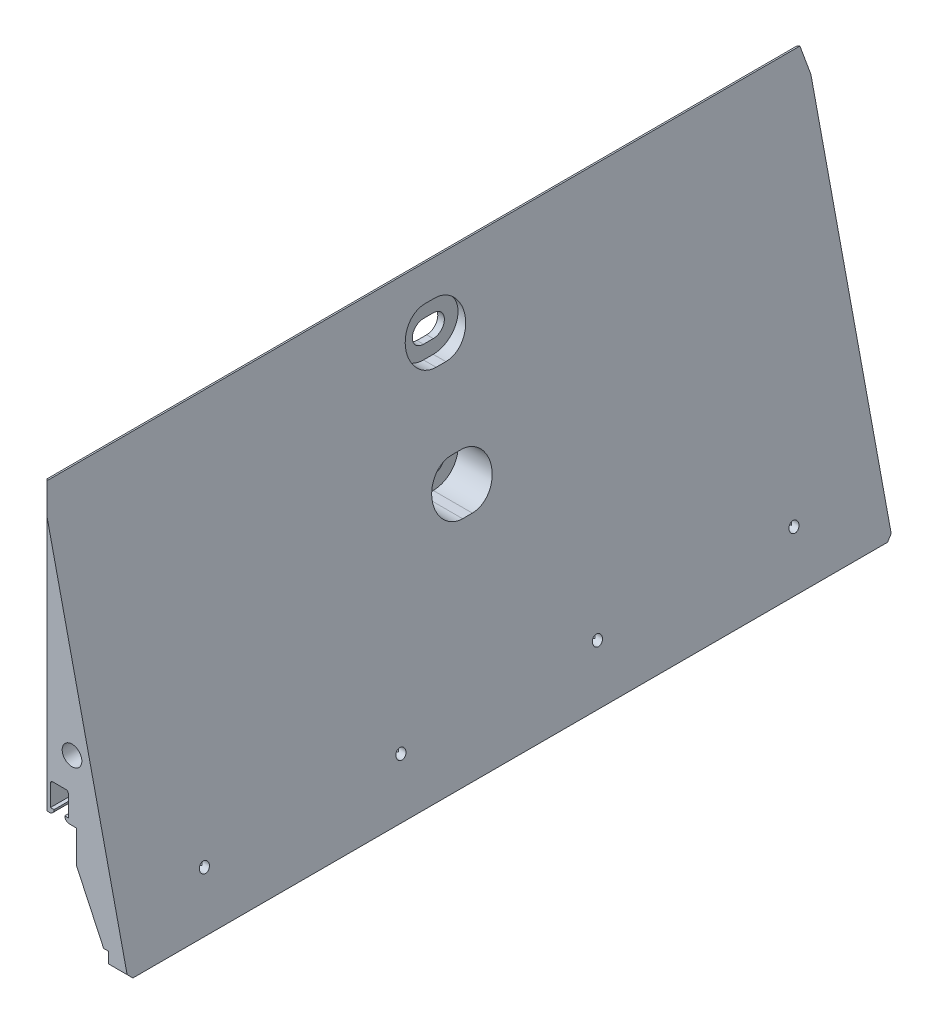
from build123d import *

# Parameters (mm, degrees)
BOSS_EXTRUDE1_DEPTH                = 61.7191425
CBORE_START                        = 1.064
CBORE_SLOT_FOR_M3_SHCS1_DEPTH      = 6.323125366
CBORE_SLOT_FOR_M3_SHCS1_2_DEPTH    = 1.064
SKETCH6_W                          = 11.1125
SKETCH6_H                          = 123.438285
CUT_EXTRUDE1_DEPTH                 = 2.54
SKETCH7_W                          = 6.35
SKETCH7_H                          = 123.438285
CUT_EXTRUDE2_DEPTH                 = 20.30984
BOSS_EXTRUDE2_START                = -61.719142
BOSS_EXTRUDE2_DEPTH                = 123.438284
SKETCH9_W                          = 0.5715
SKETCH9_H                          = 123.438285
BOSS_EXTRUDE3_DEPTH                = 5.6642
FILLET2_R                          = 0.381
CHAMFER2_SIZE                      = 0.762
CHAMFER3_SIZE                      = 3.96875
CHAMFER3_SIZE2                     = 8.511011841
AIR_ASSIST_HOLES_REACH             = 100.109
AIR_START                          = 9.128125
SKETCH11_R                         = 0.79375
F_1_8_0_125_DIAMETER_HOLE1_D       = 3.175
SKETCH13_R                         = 1.190625
CUT_EXTRUDE4_DEPTH                 = 49.2125
F_1_8_0_125_DIAMETER_HOLE2_REACH   = 90.981
F_1_8_0_125_DIAMETER_HOLE2_BORE_R  = 1.5875
M5X0_8_TAPPED_HOLE1_D              = 4.2
M5X0_8_TAPPED_HOLE1_DEPTH          = 4.7752
M5X0_8_TAPPED_HOLE1_TIP            = 1.2618073
MATERIAL_FOR_ANGLED_AIR_PORT_DEPTH = 123.438285


# Read off the part's stored shape, not the designer's step: CBORE SLOT for M3 SHCS1
with BuildPart() as part:
    # Sketch1 → Boss-Extrude1 (new, symmetric)
    with BuildSketch(Plane.XY):
        Polygon((0, 0), (14.2875, 0), (0.254, 62.484), (0, 62.484), align=None)
    extrude(amount=BOSS_EXTRUDE1_DEPTH, both=True)

    # CBORE SLOT for M3 SHCS1 outline → CBORE SLOT for M3 SHCS1 (cut)
    with BuildSketch(Plane.YZ.offset(CBORE_START)):
        with BuildLine():
            ThreePointArc((57.77484, 0.7866), (53.77434, 4.7871), (49.77384, 0.7866))
            Line((49.77384, 0.7866), (49.77384, -0.7866))
            ThreePointArc((49.77384, -0.7866), (53.77434, -4.7871), (57.77484, -0.7866))
            Line((57.77484, -0.7866), (57.77484, 0.7866))
        make_face()
        with BuildLine():
            ThreePointArc((38.72484, 0.7866), (34.72434, 4.7871), (30.72384, 0.7866))
            Line((30.72384, 0.7866), (30.72384, -0.7866))
            ThreePointArc((30.72384, -0.7866), (34.72434, -4.7871), (38.72484, -0.7866))
            Line((38.72484, -0.7866), (38.72484, 0.7866))
        make_face()
    extrude(amount=CBORE_SLOT_FOR_M3_SHCS1_DEPTH, mode=Mode.SUBTRACT)

    # CBORE SLOT for M3 SHCS1 2 outline → CBORE SLOT for M3 SHCS1 2 (cut)
    with BuildSketch(Plane.YZ):
        with BuildLine():
            Line((55.57434, -0.7866), (55.57434, 0.7866))
            ThreePointArc((55.57434, 0.7866), (53.77434, 2.5866), (51.97434, 0.7866))
            Line((51.97434, 0.7866), (51.97434, -0.7866))
            ThreePointArc((51.97434, -0.7866), (53.77434, -2.5866), (55.57434, -0.7866))
        make_face()
        with BuildLine():
            Line((36.52434, -0.7866), (36.52434, 0.7866))
            ThreePointArc((36.52434, 0.7866), (34.72434, 2.5866), (32.92434, 0.7866))
            Line((32.92434, 0.7866), (32.92434, -0.7866))
            ThreePointArc((32.92434, -0.7866), (34.72434, -2.5866), (36.52434, -0.7866))
        make_face()
    extrude(amount=CBORE_SLOT_FOR_M3_SHCS1_2_DEPTH, mode=Mode.SUBTRACT)

    # Sketch6 → Cut-Extrude1 (cut)
    with BuildSketch(Plane.XZ):
        with Locations((5.55625, 0)):
            Rectangle(SKETCH6_W, SKETCH6_H)
    extrude(amount=-CUT_EXTRUDE1_DEPTH, mode=Mode.SUBTRACT)

    # Sketch7 → Cut-Extrude2 (cut)
    with BuildSketch(Plane.XZ.offset(-2.54)):
        with Locations((3.175, 0)):
            Rectangle(SKETCH7_W, SKETCH7_H)
    extrude(amount=-CUT_EXTRUDE2_DEPTH, mode=Mode.SUBTRACT)

    # Sketch8 → Boss-Extrude2 (add)
    with BuildSketch(Plane.XY.offset(BOSS_EXTRUDE2_START)):
        with BuildLine():
            Line((5.7785, 22.84984), (5.7785, 17.18564))
            Line((5.7785, 17.18564), (4.8006, 17.18564))
            ThreePointArc((4.8006, 17.18564), (4.261784633, 17.408824633), (4.0386, 17.94764))
            Line((4.0386, 17.94764), (4.6228, 17.94764))
            Line((4.6228, 17.94764), (4.6228, 21.73224))
            Line((4.6228, 21.73224), (1.7272, 21.73224))
            Line((1.7272, 21.73224), (1.7272, 17.94764))
            Line((1.7272, 17.94764), (2.3114, 17.94764))
            ThreePointArc((2.3114, 17.94764), (2.088215367, 17.408824633), (1.5494, 17.18564))
            Line((1.5494, 17.18564), (0.5715, 17.18564))
            Line((0.5715, 17.18564), (0.5715, 22.84984))
            Line((0.5715, 22.84984), (5.7785, 22.84984))
        make_face()
    extrude(amount=BOSS_EXTRUDE2_DEPTH)

    # Sketch9 → Boss-Extrude3 (add)
    with BuildSketch(Plane.XZ.offset(-17.18564)):
        with Locations((6.06425, 0)):
            Rectangle(SKETCH9_W, SKETCH9_H)
    extrude(amount=-BOSS_EXTRUDE3_DEPTH)

    # Fillet2
    fillet2_edges = [part.edges().sort_by_distance(p)[0] for p in [
        (1.7272, 21.73224, 0),
        (4.6228, 21.73224, 0),
    ]]
    fillet(fillet2_edges, radius=FILLET2_R)

    # Chamfer2
    chamfer2_edges = [part.edges().sort_by_distance(p)[0] for p in [
        (12.7, 0, -61.7191425),
        (12.7, 0, 61.7191425),
    ]]
    chamfer(chamfer2_edges, length=CHAMFER2_SIZE)

    # Chamfer3
    chamfer3_edges = [part.edges().sort_by_distance(p)[0] for p in [
        (6.35, 2.54, 0),
    ]]
    chamfer3_side = [part.faces().sort_by_distance(p)[0] for p in [
        (8.73125, 2.54, 0),
    ]]
    chamfer(chamfer3_edges, length=CHAMFER3_SIZE, length2=CHAMFER3_SIZE2, reference=chamfer3_side[0])

    # Chamfer1
    # the kernel refuses this chamfer: 1.143 mm, written as the material it takes off along each edge
    with BuildSketch(Plane(origin=(0, 69.538640773, 61.7191425), x_dir=(0.9996219169112965, 0, 0.027495876610588797), z_dir=(0, -1, 0)), Plane(origin=(0, 69.538640773, -61.7191425), x_dir=(-0.027495876610586282, 0, 0.9996219169112968), z_dir=(0, -1, 0))) as chamfer1_piece_1:
        with BuildLine():
            Line((1.175773462, 0), (-0.064633398, -1.173995638))
            Line((-0.064633398, -1.173995638), (-0.087484755, -1.173367082))
            ThreePointArc((-0.087484755, -1.173367082), (-0.039009707, -0.586813719), (-0.022851357, 0.000628556))
            Line((-0.022851357, 0.000628556), (0.000628556, 0.022851357))
            ThreePointArc((0.000628556, 0.022851357), (0.588070831, 0.006693008), (1.176402018, 0.022851357))
            Line((1.176402018, 0.022851357), (1.175773462, 0))
        make_face()
    extrude(amount=53.743441545, mode=Mode.SUBTRACT)

    # Air assist holes: up to this plane
    air_assist_holes_end = Plane(origin=(14.2875, 0, 61.7191425), z_dir=(-0.9756946233195241, -0.21913466641627521, 0))
    # Sketch11 → Air assist holes (cut, up to the surface)
    with BuildSketch(Plane(origin=(0, 0, 0), x_dir=(0, 0, -1), z_dir=(1, 0, 0)).offset(AIR_START), mode=Mode.PRIVATE) as air_assist_holes_sk1:
        with Locations(Location((-15.875, 7.9375, 0), (0, 0, 90))):
            Circle(SKETCH11_R)
    air_assist_holes_tool1 = split(extrude(air_assist_holes_sk1.sketch, amount=AIR_ASSIST_HOLES_REACH, mode=Mode.PRIVATE), bisect_by=air_assist_holes_end, keep=Keep.BOTH, mode=Mode.PRIVATE)
    add(air_assist_holes_tool1.solids().sort_by_distance((9.128125, 7.9375, 15.875))[0], mode=Mode.SUBTRACT)
    # Sketch11 → Air assist holes (cut, up to the surface)
    with BuildSketch(Plane(origin=(0, 0, 0), x_dir=(0, 0, -1), z_dir=(1, 0, 0)).offset(AIR_START), mode=Mode.PRIVATE) as air_assist_holes_sk2:
        with Locations(Location((-47.625, 7.9375, 0), (0, 0, 90))):
            Circle(SKETCH11_R)
    air_assist_holes_tool2 = split(extrude(air_assist_holes_sk2.sketch, amount=AIR_ASSIST_HOLES_REACH, mode=Mode.PRIVATE), bisect_by=air_assist_holes_end, keep=Keep.BOTH, mode=Mode.PRIVATE)
    add(air_assist_holes_tool2.solids().sort_by_distance((9.128125, 7.9375, 47.625))[0], mode=Mode.SUBTRACT)
    # Sketch11 → Air assist holes (cut, up to the surface)
    with BuildSketch(Plane(origin=(0, 0, 0), x_dir=(0, 0, -1), z_dir=(1, 0, 0)).offset(AIR_START), mode=Mode.PRIVATE) as air_assist_holes_sk3:
        with Locations(Location((47.625, 7.9375, 0), (0, 0, 180))):
            Circle(SKETCH11_R)
    air_assist_holes_tool3 = split(extrude(air_assist_holes_sk3.sketch, amount=AIR_ASSIST_HOLES_REACH, mode=Mode.PRIVATE), bisect_by=air_assist_holes_end, keep=Keep.BOTH, mode=Mode.PRIVATE)
    add(air_assist_holes_tool3.solids().sort_by_distance((9.128125, 7.9375, -47.625))[0], mode=Mode.SUBTRACT)
    # Sketch11 → Air assist holes (cut, up to the surface)
    with BuildSketch(Plane(origin=(0, 0, 0), x_dir=(0, 0, -1), z_dir=(1, 0, 0)).offset(AIR_START), mode=Mode.PRIVATE) as air_assist_holes_sk4:
        with Locations(Location((15.875, 7.9375, 0), (0, 0, 180))):
            Circle(SKETCH11_R)
    air_assist_holes_tool4 = split(extrude(air_assist_holes_sk4.sketch, amount=AIR_ASSIST_HOLES_REACH, mode=Mode.PRIVATE), bisect_by=air_assist_holes_end, keep=Keep.BOTH, mode=Mode.PRIVATE)
    add(air_assist_holes_tool4.solids().sort_by_distance((9.128125, 7.9375, -15.875))[0], mode=Mode.SUBTRACT)

    # 1/8 (0.125) Diameter Hole1 (through all)
    with Locations(Plane.XY.offset(61.7191425)):
        with Locations((5.214317884, 26.9875)):
            Hole(F_1_8_0_125_DIAMETER_HOLE1_D / 2)

    # Sketch13 → Cut-Extrude4 (cut)
    with BuildSketch(Plane(origin=(-2.199010525, 54.654418275, 15.875), x_dir=(0.9659258262890692, 0.25881904510251796, 0), z_dir=(-0.25881904510251796, 0.9659258262890692, 0))):
        with Locations(Location((0, 0, 0), (0, 0, 180))):
            Circle(SKETCH13_R)
        with Locations(Location((0, -31.75, 0), (0, 0, 180))):
            Circle(SKETCH13_R)
    cut_extrude4 = extrude(amount=-CUT_EXTRUDE4_DEPTH, mode=Mode.SUBTRACT)

    # Mirror2: Cut-Extrude4 across plane
    add(cut_extrude4.mirror(Plane.XY), mode=Mode.SUBTRACT)

    # 1/8 (0.125) Diameter Hole2 bore → 1/8 (0.125) Diameter Hole2 (cut, up to next)
    with BuildSketch(Plane.ZY, mode=Mode.PRIVATE) as f_1_8_0_125_diameter_hole2_sk1:
        with Locations((-41.275, 26.9875)):
            Circle(F_1_8_0_125_DIAMETER_HOLE2_BORE_R)
    f_1_8_0_125_diameter_hole2_tool1 = extrude(f_1_8_0_125_diameter_hole2_sk1.sketch, amount=-F_1_8_0_125_DIAMETER_HOLE2_REACH, mode=Mode.PRIVATE) & part.part
    add(f_1_8_0_125_diameter_hole2_tool1.solids().sort_by_distance((0, 26.9875, -41.275))[0], mode=Mode.SUBTRACT)

    # M5x0.8 Tapped Hole1
    with Locations(Plane.ZY):
        with Locations((-41.275, 26.9875)):
            Hole(M5X0_8_TAPPED_HOLE1_D / 2, depth=M5X0_8_TAPPED_HOLE1_DEPTH)
            with Locations((0, 0, -(M5X0_8_TAPPED_HOLE1_DEPTH + M5X0_8_TAPPED_HOLE1_TIP / 2))):  # 118° drill point
                Cone(0, M5X0_8_TAPPED_HOLE1_D / 2, M5X0_8_TAPPED_HOLE1_TIP, mode=Mode.SUBTRACT)

    # Sketch23 → material for angled air port (add, through all)
    with BuildSketch(Plane(origin=(0, 0, -61.7191425), x_dir=(-1, 0, 0), z_dir=(0, 0, -1))):
        Polygon((-6.35, 11.051011841), (-5.953125, 11.902113025), (-5.953125, 17.18564), (-6.35, 17.18564), align=None)
    extrude(amount=-MATERIAL_FOR_ANGLED_AIR_PORT_DEPTH)


solid = part.part
